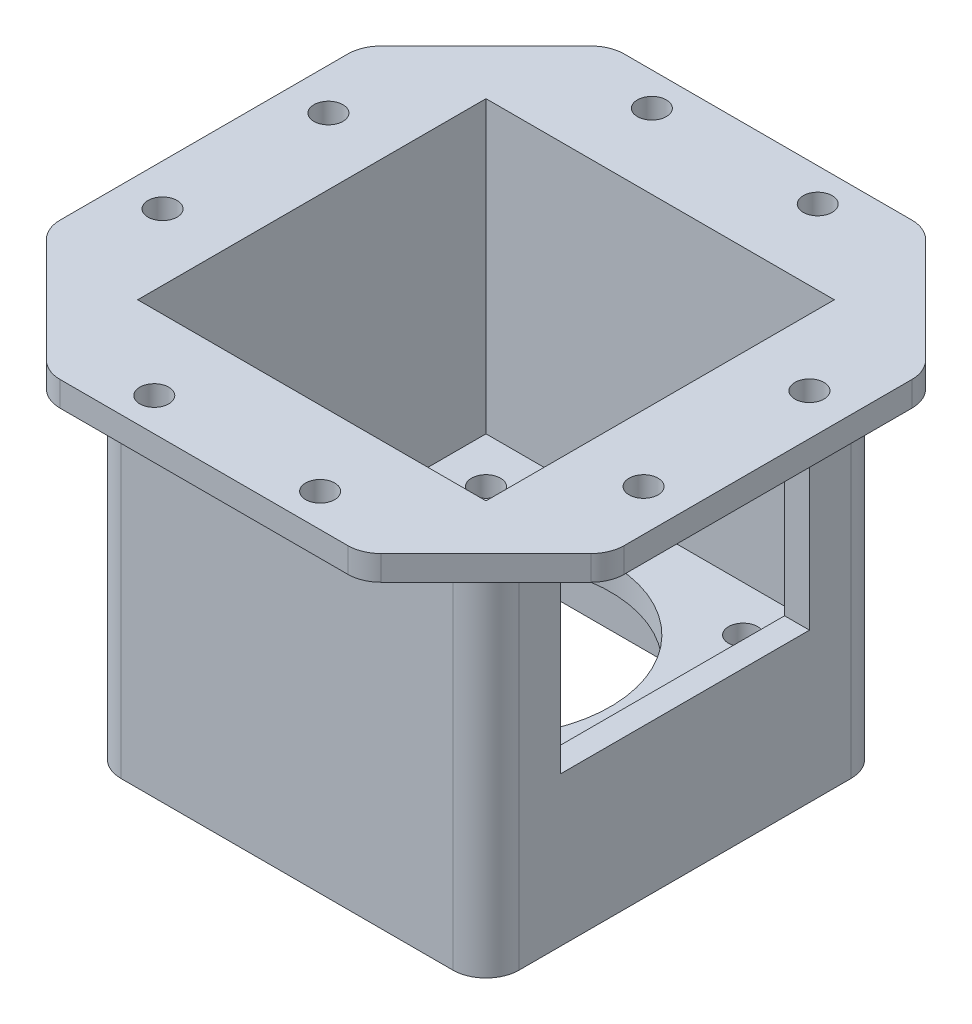
from build123d import *

# Parameters (mm, degrees)
SKETCH2_W           = 48
SKETCH2_H           = 48
SKETCH2_R           = 15
SKETCH2_R_2         = 1.75
BOSS_EXTRUDE1_DEPTH = 3
SKETCH3_W           = 48
SKETCH3_H           = 48
SKETCH3_W_2         = 42
SKETCH3_H_2         = 42
BOSS_EXTRUDE2_DEPTH = 32
SKETCH4_W           = 68
SKETCH4_H           = 68
SKETCH4_R           = 1.75
SKETCH4_W_2         = 42
SKETCH4_H_2         = 42
BOSS_EXTRUDE3_DEPTH = 3
CHAMFER1_SIZE       = 15
SKETCH5_W           = 48
SKETCH5_H           = 48
SKETCH5_W_2         = 42
SKETCH5_H_2         = 42
BOSS_EXTRUDE4_DEPTH = 10
FILLET1_R           = 4
CUT_EXTRUDE2_REACH  = 79.227
SKETCH7_W           = 30
SKETCH7_H           = 20
FILLET2_R           = 4


with BuildPart() as part:
    # Sketch2 → Boss-Extrude1 (new body)
    with BuildSketch(Plane(origin=(0, 0, 0), x_dir=(1, 0, 0), z_dir=(0, 1, 0))):
        Rectangle(SKETCH2_W, SKETCH2_H)
        Circle(SKETCH2_R, mode=Mode.SUBTRACT)
        with Locations((-15.5, 15.5)):
            Circle(SKETCH2_R_2, mode=Mode.SUBTRACT)
        with Locations((15.5, 15.5)):
            Circle(SKETCH2_R_2, mode=Mode.SUBTRACT)
        with Locations((15.5, -15.5)):
            Circle(SKETCH2_R_2, mode=Mode.SUBTRACT)
        with Locations((-15.5, -15.5)):
            Circle(SKETCH2_R_2, mode=Mode.SUBTRACT)
    extrude(amount=BOSS_EXTRUDE1_DEPTH)

    # Sketch3 → Boss-Extrude2 (add)
    with BuildSketch(Plane(origin=(0, 3, 0), x_dir=(1, 0, 0), z_dir=(0, 1, 0))):
        Rectangle(SKETCH3_W, SKETCH3_H)
        Rectangle(SKETCH3_W_2, SKETCH3_H_2, mode=Mode.SUBTRACT)
    extrude(amount=BOSS_EXTRUDE2_DEPTH)

    # Sketch4 → Boss-Extrude3 (add)
    with BuildSketch(Plane(origin=(0, 35, 0), x_dir=(1, 0, 0), z_dir=(0, 1, 0))):
        Rectangle(SKETCH4_W, SKETCH4_H)
        with Locations((-10, 30)):
            Circle(SKETCH4_R, mode=Mode.SUBTRACT)
        with Locations((10, 30)):
            Circle(SKETCH4_R, mode=Mode.SUBTRACT)
        with Locations((-29, 10)):
            Circle(SKETCH4_R, mode=Mode.SUBTRACT)
        with Locations((-29, -10)):
            Circle(SKETCH4_R, mode=Mode.SUBTRACT)
        with Locations((-10, -30)):
            Circle(SKETCH4_R, mode=Mode.SUBTRACT)
        with Locations((10, -30)):
            Circle(SKETCH4_R, mode=Mode.SUBTRACT)
        with Locations((29, -10)):
            Circle(SKETCH4_R, mode=Mode.SUBTRACT)
        with Locations((29, 10)):
            Circle(SKETCH4_R, mode=Mode.SUBTRACT)
        Rectangle(SKETCH4_W_2, SKETCH4_H_2, mode=Mode.SUBTRACT)
    extrude(amount=BOSS_EXTRUDE3_DEPTH)

    # Chamfer1
    chamfer1_edges = [part.edges().sort_by_distance(p)[0] for p in [
        (34, 36.5, 34),
        (34, 36.5, -34),
        (-34, 36.5, -34),
        (-34, 36.5, 34),
    ]]
    chamfer(chamfer1_edges, length=CHAMFER1_SIZE)

    # Sketch5 → Boss-Extrude4 (add)
    with BuildSketch(Plane.XZ):
        Rectangle(SKETCH5_W, SKETCH5_H)
        Rectangle(SKETCH5_W_2, SKETCH5_H_2, mode=Mode.SUBTRACT)
    extrude(amount=BOSS_EXTRUDE4_DEPTH)

    # Fillet1
    fillet1_edges = [part.edges().sort_by_distance(p)[0] for p in [
        (-24, 12.5, 24),
        (-24, 12.5, -24),
        (24, 12.5, 24),
        (24, 12.5, -24),
    ]]
    fillet(fillet1_edges, radius=FILLET1_R)

    # Sketch7 → Cut-Extrude2 (cut, up to next)
    with BuildSketch(Plane(origin=(24, 0, 0), x_dir=(0, 0, -1), z_dir=(1, 0, 0)), mode=Mode.PRIVATE) as cut_extrude2_sk1:
        with Locations((0, 18)):
            Rectangle(SKETCH7_W, SKETCH7_H)
    cut_extrude2_tool1 = extrude(cut_extrude2_sk1.sketch, amount=-CUT_EXTRUDE2_REACH, mode=Mode.PRIVATE) & part.part
    add(cut_extrude2_tool1.solids().sort_by_distance((24, 18, 0))[0], mode=Mode.SUBTRACT)

    # Fillet2
    fillet2_edges = [part.edges().sort_by_distance(p)[0] for p in [
        (-19, 36.5, 34),
        (-34, 36.5, 19),
        (-34, 36.5, -19),
        (-19, 36.5, -34),
        (19, 36.5, -34),
        (34, 36.5, -19),
        (19, 36.5, 34),
        (34, 36.5, 19),
    ]]
    fillet(fillet2_edges, radius=FILLET2_R)


solid = part.part
